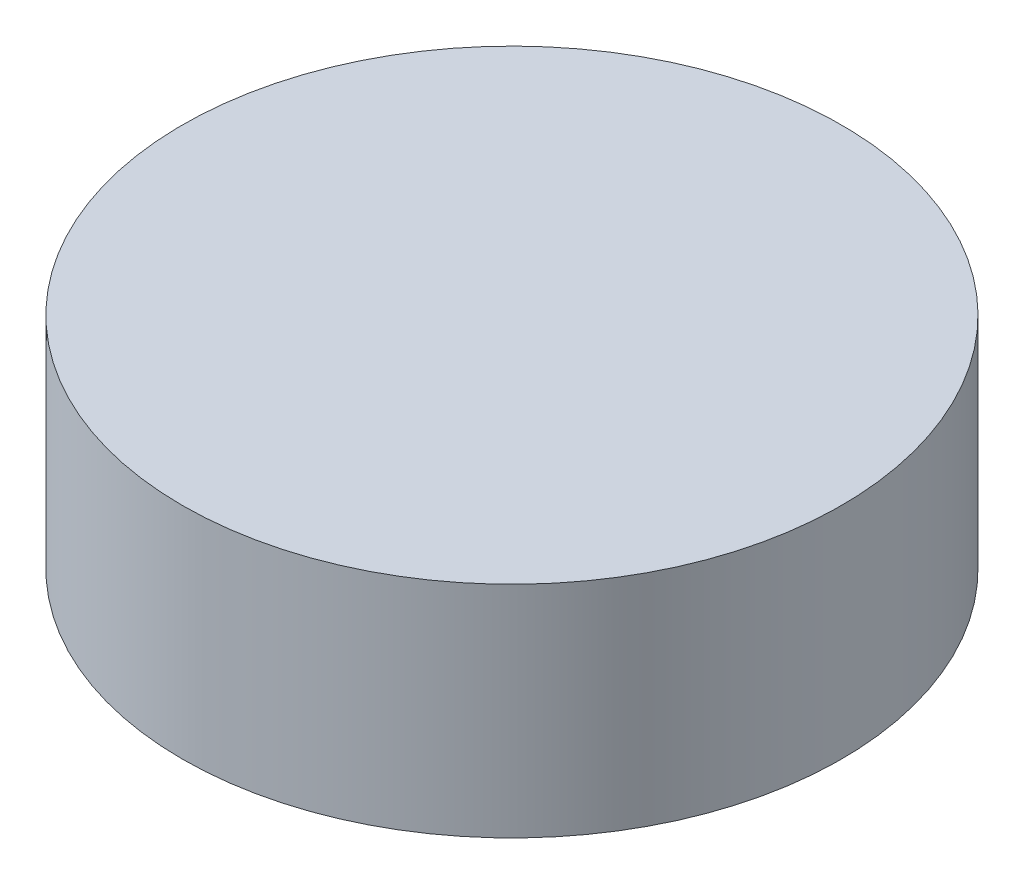
from build123d import *

# Parameters (mm, degrees)
SKETCH1_R           = 150
BOSS_EXTRUDE1_DEPTH = 100


with BuildPart() as part:
    # Sketch1 → Boss-Extrude1 (new body)
    with BuildSketch(Plane(origin=(0, 0, 0), x_dir=(1, 0, 0), z_dir=(0, 1, 0))):
        Circle(SKETCH1_R)
    extrude(amount=BOSS_EXTRUDE1_DEPTH)


solid = part.part
